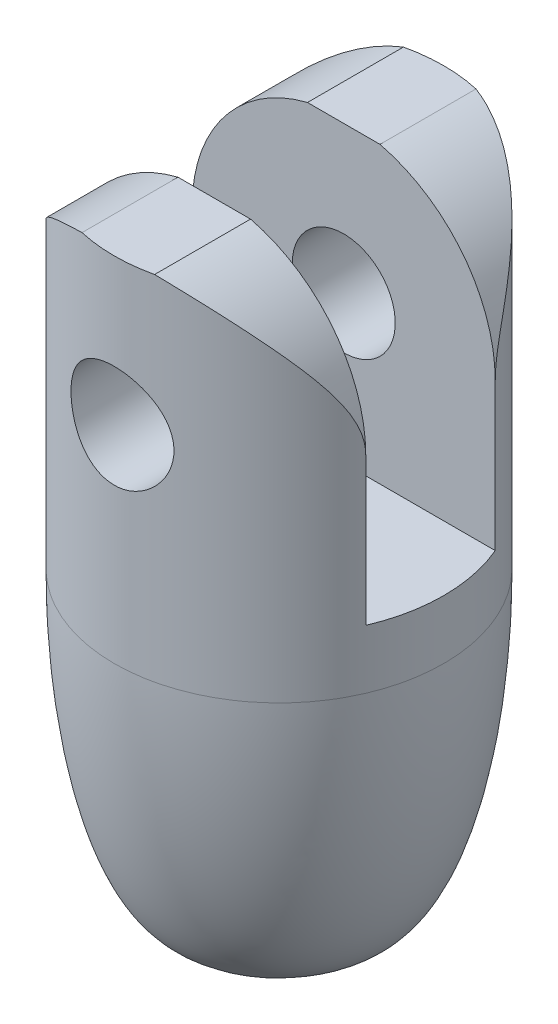
from build123d import *
from build123d.topology import SkipClean

# Parameters (mm, degrees)
SKETCH1_R               = 5.6
SKETCH1_R_2             = 1.6
BOSS_EXTRUDE1_DEPTH     = 10
SKETCH2_R               = 5.6
BOSS_EXTRUDE2_DEPTH     = 2
BOSS_EXTRUDE3_DEPTH     = 10
CUT_EXTRUDE1_DEPTH      = 25.004166
CUT_EXTRUDE1_DEPTH_BACK = 25.004166
SKETCH4_R               = 1.75
FILLET1_SIZE            = 10
FILLET1_SIZE_2          = 3


with BuildPart() as part:
    # Sketch1 → Boss-Extrude1 (new body)
    with BuildSketch(Plane(origin=(0, 0, 0), x_dir=(1, 0, 0), z_dir=(0, 1, 0))):
        with Locations(Location((0, 0, 0), (0, 0, 270))):
            Circle(SKETCH1_R)
        with Locations(Location((0, 0, 0), (0, 0, 270))):
            Circle(SKETCH1_R_2, mode=Mode.SUBTRACT)
    extrude(amount=BOSS_EXTRUDE1_DEPTH)

    # Sketch2 → Boss-Extrude2 (add)
    with BuildSketch(Plane(origin=(0, 10, 0), x_dir=(1, 0, 0), z_dir=(0, 1, 0))):
        with Locations(Location((0, 0, 0), (0, 0, 270))):
            Circle(SKETCH2_R)
    extrude(amount=BOSS_EXTRUDE2_DEPTH)

    # Sketch3 → Boss-Extrude3 (add)
    with BuildSketch(Plane(origin=(0, 12, 0), x_dir=(1, 0, 0), z_dir=(0, 1, 0))):
        with BuildLine():
            Line((-5.149757, 2.2), (5.149757, 2.2))
            ThreePointArc((5.149757, 2.2), (0, 5.6), (-5.149757, 2.2))
        make_face()
        with BuildLine():
            Line((-5.149757, -2.2), (5.149757, -2.2))
            ThreePointArc((5.149757, -2.2), (0, -5.6), (-5.149757, -2.2))
        make_face()
    extrude(amount=BOSS_EXTRUDE3_DEPTH)

    # Sketch4 → Cut-Extrude1 (cut, two sides: drawn at the far end of the back side and taken through both)
    with SkipClean():  # the faces are left unmerged after this step: merging them gives an invalid solid
        with BuildSketch(Plane(origin=(0, 0, 2.2), x_dir=(-1, 0, 0), z_dir=(0, 0, -1)).offset(-CUT_EXTRUDE1_DEPTH_BACK)):
            with BuildLine():
                Line((5.149757, 22.1), (5.149757, 22))
                Line((5.149757, 22), (1.232883, 22))
                ThreePointArc((1.232883, 22), (4.053952, 20.175764), (5.149757, 17))
                Line((5.149757, 17), (5.149757, 12))
                Line((5.149757, 12), (5.249757, 12))
                Line((5.249757, 12), (5.249757, 22.1))
                Line((5.249757, 22.1), (5.149757, 22.1))
            make_face()
            with BuildLine():
                ThreePointArc((-5.149757, 17), (-4.053952, 20.175764), (-1.232883, 22))
                Line((-1.232883, 22), (-5.149757, 22))
                Line((-5.149757, 22), (-5.149757, 22.1))
                Line((-5.149757, 22.1), (-5.249757, 22.1))
                Line((-5.249757, 22.1), (-5.249757, 12))
                Line((-5.249757, 12), (-5.149757, 12))
                Line((-5.149757, 12), (-5.149757, 17))
            make_face()
            with Locations(Location((0, 17, 0), (0, 0, 270))):
                Circle(SKETCH4_R)
        extrude(amount=CUT_EXTRUDE1_DEPTH + CUT_EXTRUDE1_DEPTH_BACK, mode=Mode.SUBTRACT)

    # Fillet1
    # an asymmetric fillet: 10, 3 mm, written as the material it takes off along each edge
    with BuildSketch(Plane(origin=(0, 0, 0), x_dir=(0, 0, 1), z_dir=(-1, 0, 0))) as fillet1_piece_1:
        with BuildLine():
            Bezier((5.6, FILLET1_SIZE), (5.6, 0), (5.6 - FILLET1_SIZE_2, 0), weights=[1, 0.707107, 1])
            Line((5.6 - FILLET1_SIZE_2, 0), (5.6, 0))
            Line((5.6, 0), (5.6, FILLET1_SIZE))
        make_face()
    revolve(axis=Axis((0, 0, 0), (0, 1, 0)), mode=Mode.SUBTRACT)


solid = part.part
